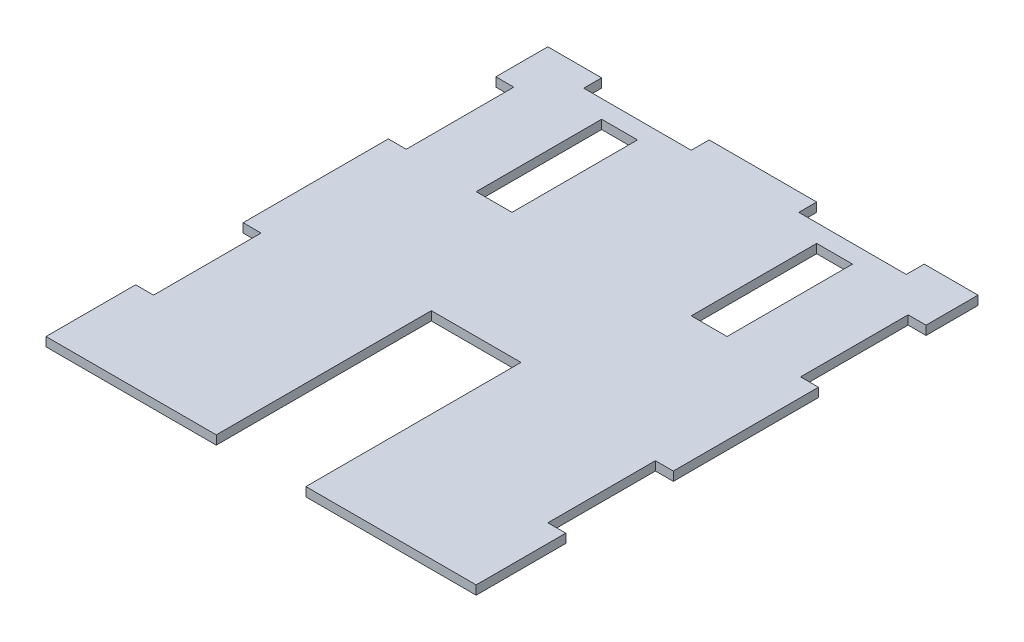
from build123d import *

# Parameters (mm, degrees)
SKETCH1_W           = 304.8
SKETCH1_H           = 355.6
BOSS_EXTRUDE1_DEPTH = 6.35
SKETCH2_W           = 63.5
SKETCH2_H           = 152.4
CUT_EXTRUDE1_DEPTH  = 235.26250767
SKETCH3_W           = 25.4
SKETCH3_H           = 88.9
CUT_EXTRUDE2_DEPTH  = 235.26250767
SKETCH4_W           = 12.7
SKETCH4_H           = 76.2
SKETCH4_W_2         = 76.2
SKETCH4_H_2         = 12.7
CUT_EXTRUDE3_DEPTH  = 235.26250767


with BuildPart() as part:
    # Sketch1 → Boss-Extrude1 (new body)
    with BuildSketch(Plane(origin=(0, 0, 0), x_dir=(1, 0, 0), z_dir=(0, 1, 0))):
        Rectangle(SKETCH1_W, SKETCH1_H)
    extrude(amount=BOSS_EXTRUDE1_DEPTH)

    # Sketch2 → Cut-Extrude1 (cut, through all)
    with BuildSketch(Plane(origin=(0, 6.35, 0), x_dir=(1, 0, 0), z_dir=(0, 1, 0))):
        with Locations((0, -101.6)):
            Rectangle(SKETCH2_W, SKETCH2_H)
    extrude(amount=-CUT_EXTRUDE1_DEPTH, mode=Mode.SUBTRACT)

    # Sketch3 → Cut-Extrude2 (cut, through all)
    with BuildSketch(Plane(origin=(0, 6.35, 0), x_dir=(1, 0, 0), z_dir=(0, 1, 0))):
        with Locations((76.2, 107.95)):
            Rectangle(SKETCH3_W, SKETCH3_H)
        with Locations((-76.2, 107.95)):
            Rectangle(SKETCH3_W, SKETCH3_H)
    extrude(amount=-CUT_EXTRUDE2_DEPTH, mode=Mode.SUBTRACT)

    # Sketch4 → Cut-Extrude3 (cut, through all)
    with BuildSketch(Plane(origin=(0, 6.35, 0), x_dir=(1, 0, 0), z_dir=(0, 1, 0))):
        with Locations((-146.05, 102.87)):
            Rectangle(SKETCH4_W, SKETCH4_H)
        with Locations((-146.05, -76.2)):
            Rectangle(SKETCH4_W, SKETCH4_H)
        with Locations((146.05, 102.87)):
            Rectangle(SKETCH4_W, SKETCH4_H)
        with Locations((146.05, -76.2)):
            Rectangle(SKETCH4_W, SKETCH4_H)
        with Locations((76.2, 171.45)):
            Rectangle(SKETCH4_W_2, SKETCH4_H_2)
        with Locations((-76.2, 171.45)):
            Rectangle(SKETCH4_W_2, SKETCH4_H_2)
    extrude(amount=-CUT_EXTRUDE3_DEPTH, mode=Mode.SUBTRACT)


solid = part.part
